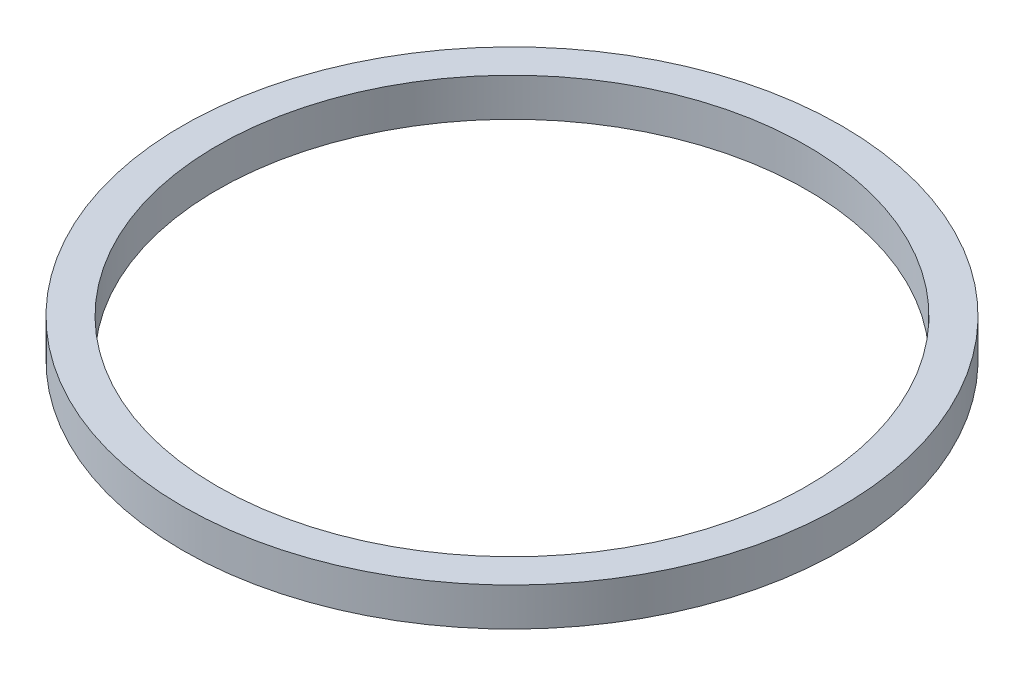
from build123d import *

# Parameters (mm, degrees)
SKETCH2_R           = 9.5
SKETCH2_R_2         = 8.5
BOSS_EXTRUDE1_DEPTH = 1.1


with BuildPart() as part:
    # Sketch2 → Boss-Extrude1 (new body)
    with BuildSketch(Plane(origin=(0, 0, 0), x_dir=(1, 0, 0), z_dir=(0, 1, 0))):
        Circle(SKETCH2_R)
        Circle(SKETCH2_R_2, mode=Mode.SUBTRACT)
    extrude(amount=BOSS_EXTRUDE1_DEPTH)


solid = part.part
